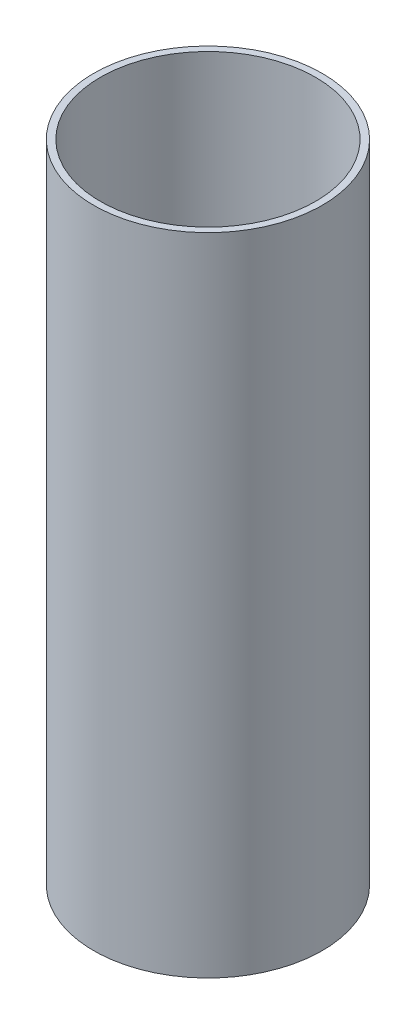
from build123d import *

# Parameters (mm, degrees)
SKETCH1_R           = 107.95
SKETCH1_R_2         = 101.6
BOSS_EXTRUDE1_DEPTH = 609.6


with BuildPart() as part:
    # Sketch1 → Boss-Extrude1 (new body)
    with BuildSketch(Plane(origin=(0, 0, 0), x_dir=(1, 0, 0), z_dir=(0, 1, 0))):
        Circle(SKETCH1_R)
        Circle(SKETCH1_R_2, mode=Mode.SUBTRACT)
    extrude(amount=BOSS_EXTRUDE1_DEPTH)


solid = part.part
